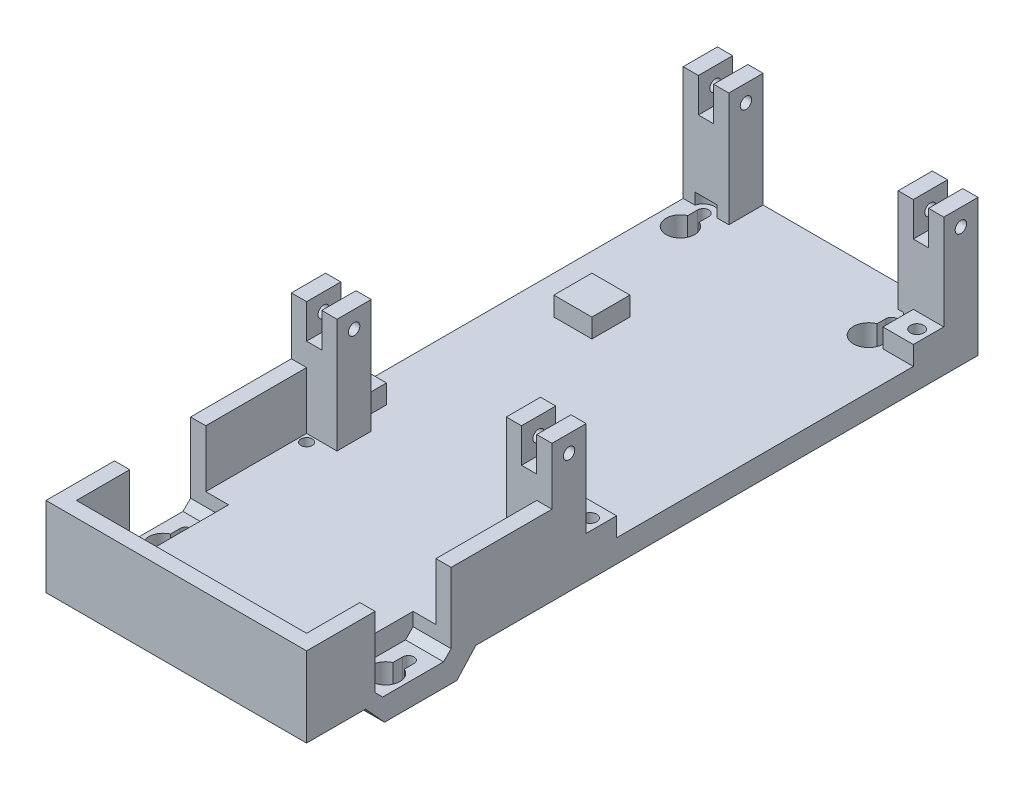
from build123d import *
from OCP.BRepFilletAPI import BRepFilletAPI_MakeChamfer

# Parameters (mm, degrees)
SKETCH1_W            = 68.5
SKETCH1_H            = 64.5
BOSS_EXTRUDE3_DEPTH  = 21
SKETCH3_W            = 60.5
SKETCH3_H            = 60.5
CUT_EXTRUDE1_DEPTH   = 15
SKETCH5_W            = 68.5
SKETCH5_H            = 6
BOSS_EXTRUDE4_DEPTH  = 105
SKETCH10_W           = 10
SKETCH10_H           = 29
BOSS_EXTRUDE5_DEPTH  = 5.5
SKETCH9_W            = 4
SKETCH9_H            = 20
CUT_EXTRUDE2_DEPTH   = 20.5
SKETCH11_W           = 6
SKETCH11_H           = 20
CUT_EXTRUDE3_DEPTH   = 5.5
CHAMFER2_SIZE        = 5.5
CHAMFER2_SIZE_2      = 5
CHAMFER3_SIZE        = 2
SKETCH12_W           = 34.25
SKETCH12_H           = 169.5
CUT_EXTRUDE4_DEPTH   = 50
SKETCH15_R           = 1.5
CUT_EXTRUDE5_DEPTH   = 50
SKETCH16_R           = 1.5
CUT_EXTRUDE6_DEPTH   = 50
SKETCH17_R           = 1.5
CUT_EXTRUDE7_DEPTH   = 50
SKETCH19_W           = 34.25
SKETCH19_H           = 6
BOSS_EXTRUDE6_DEPTH  = 7
SKETCH26_W           = 12
SKETCH26_H           = 9
BOSS_EXTRUDE7_DEPTH  = 30
SKETCH20_R           = 3.75
CUT_EXTRUDE9_DEPTH   = 184.263642057
SKETCH21_W           = 3
SKETCH21_H           = 2.563068229
CUT_EXTRUDE10_DEPTH  = 184.263642057
SKETCH18_R           = 1.5
CUT_EXTRUDE8_DEPTH   = 135
SKETCH24_R           = 4
CUT_EXTRUDE13_DEPTH  = 183.278118544
SKETCH25_W           = 3
SKETCH25_H           = 2.291900756
CUT_EXTRUDE14_DEPTH  = 183.278118544
SKETCH27_R           = 1.75
CUT_EXTRUDE15_DEPTH  = 183.278118544
BOSS_EXTRUDE9_START  = 5
SKETCH30_W           = 8
SKETCH30_H           = 8
SKETCH30_R           = 1.75
BOSS_EXTRUDE9_DEPTH  = 5
SKETCH31_W           = 8
SKETCH31_H           = 8
CUT_EXTRUDE16_DEPTH  = 5
SKETCH32_W           = 19.705511252
SKETCH32_H           = 22.257631466
BOSS_EXTRUDE10_DEPTH = 6
SKETCH33_R           = 1.5
CUT_EXTRUDE17_DEPTH  = 9.74
SKETCH34_R           = 3.75
CUT_EXTRUDE18_DEPTH  = 192.688549475
SKETCH36_R           = 2.5
CUT_EXTRUDE20_DEPTH  = 2
SKETCH39_W           = 3
SKETCH39_H           = 4.259893973
CUT_EXTRUDE22_DEPTH  = 192.688549475
SKETCH41_W           = 12
SKETCH41_H           = 9
BOSS_EXTRUDE11_DEPTH = 30
SKETCH42_R           = 3
CUT_EXTRUDE23_DEPTH  = 3
SKETCH44_W           = 10
SKETCH44_H           = 10
BOSS_EXTRUDE12_DEPTH = 5
SKETCH47_R           = 2.5
CUT_EXTRUDE26_DEPTH  = 3
SKETCH46_W           = 4
SKETCH46_H           = 9
CUT_EXTRUDE27_DEPTH  = 9
CUT_EXTRUDE28_START  = -68.5
SKETCH48_R           = 1.5
CUT_EXTRUDE28_DEPTH  = 68.5


with BuildPart() as part:
    # Sketch1 → Boss-Extrude3 (new body)
    with BuildSketch(Plane(origin=(0, 0, 0), x_dir=(1, 0, 0), z_dir=(0, 1, 0))):
        with Locations((-34.25, 32.25)):
            Rectangle(SKETCH1_W, SKETCH1_H)
    extrude(amount=BOSS_EXTRUDE3_DEPTH)

    # Sketch3 → Cut-Extrude1 (cut)
    with BuildSketch(Plane(origin=(0, 21, 0), x_dir=(1, 0, 0), z_dir=(0, 1, 0))):
        with Locations((-34.25, 34.25)):
            Rectangle(SKETCH3_W, SKETCH3_H)
    extrude(amount=-CUT_EXTRUDE1_DEPTH, mode=Mode.SUBTRACT)

    # Sketch5 → Boss-Extrude4 (add)
    with BuildSketch(Plane(origin=(0, 0, -64.5), x_dir=(-1, 0, 0), z_dir=(0, 0, -1))):
        with Locations((34.25, 3)):
            Rectangle(SKETCH5_W, SKETCH5_H)
    extrude(amount=BOSS_EXTRUDE4_DEPTH)

    # Sketch10 → Boss-Extrude5 (add)
    with BuildSketch(Plane.XZ):
        with Locations((-5, -30)):
            Rectangle(SKETCH10_W, SKETCH10_H)
    extrude(amount=BOSS_EXTRUDE5_DEPTH)

    # Sketch9 → Cut-Extrude2 (cut)
    with BuildSketch(Plane(origin=(0, 21, 0), x_dir=(1, 0, 0), z_dir=(0, 1, 0))):
        with Locations((-2, 28)):
            Rectangle(SKETCH9_W, SKETCH9_H)
    extrude(amount=-CUT_EXTRUDE2_DEPTH, mode=Mode.SUBTRACT)

    # Sketch11 → Cut-Extrude3 (cut)
    with BuildSketch(Plane(origin=(0, 6, 0), x_dir=(1, 0, 0), z_dir=(0, 1, 0))):
        with Locations((-7, 28)):
            Rectangle(SKETCH11_W, SKETCH11_H)
    extrude(amount=-CUT_EXTRUDE3_DEPTH, mode=Mode.SUBTRACT)

    # Chamfer2
    chamfer2_edges_1 = [part.edges().sort_by_distance(p)[0] for p in [
        (-5, -5.5, -44.5),
    ]]
    chamfer2_side_1 = [part.faces().sort_by_distance(p)[0] for p in [
        (-5, -5.4, -44.5),
    ]]
    chamfer2_edges_2 = [part.edges().sort_by_distance(p)[0] for p in [
        (-5, -5.5, -15.5),
    ]]
    chamfer2_side_2 = [part.faces().sort_by_distance(p)[0] for p in [
        (-5, -5.5, -15.6),
    ]]
    chamfer2 = BRepFilletAPI_MakeChamfer(part.part.solid().wrapped)
    for e in chamfer2_edges_1:
        chamfer2.Add(CHAMFER2_SIZE - 0.0001, CHAMFER2_SIZE_2 - 0.0001, e.wrapped, chamfer2_side_1[0].wrapped)
    for e in chamfer2_edges_2:
        chamfer2.Add(CHAMFER2_SIZE_2 - 0.0001, CHAMFER2_SIZE - 0.0001, e.wrapped, chamfer2_side_2[0].wrapped)
    add(Compound.cast(chamfer2.Shape()), mode=Mode.REPLACE)  # a hair under: the kernel refuses the full size

    # Chamfer3
    chamfer3_edges = [part.edges().sort_by_distance(p)[0] for p in [
        (-5, 0.5, -38),
        (-5, 0.5, -18),
    ]]
    chamfer(chamfer3_edges, length=CHAMFER3_SIZE)

    # Sketch12 → Cut-Extrude4 (cut)
    with BuildSketch(Plane(origin=(0, 21, 0), x_dir=(1, 0, 0), z_dir=(0, 1, 0))):
        with Locations((-51.375, 84.75)):
            Rectangle(SKETCH12_W, SKETCH12_H)
    extrude(amount=-CUT_EXTRUDE4_DEPTH, mode=Mode.SUBTRACT)

    # Sketch15 → Cut-Extrude5 (cut)
    with BuildSketch(Plane(origin=(0, 0.5, 0), x_dir=(1, 0, 0), z_dir=(0, 1, 0))):
        with Locations(Location((-5, 31.75713966, 0), (0, 0, 270))):
            Circle(SKETCH15_R)
    extrude(amount=-CUT_EXTRUDE5_DEPTH, mode=Mode.SUBTRACT)

    # Sketch16 → Cut-Extrude6 (cut)
    with BuildSketch(Plane(origin=(0, 6, 0), x_dir=(1, 0, 0), z_dir=(0, 1, 0))):
        with Locations(Location((-6, 6, 0), (0, 0, 270))):
            Circle(SKETCH16_R)
    extrude(amount=-CUT_EXTRUDE6_DEPTH, mode=Mode.SUBTRACT)

    # Sketch17 → Cut-Extrude7 (cut)
    with BuildSketch(Plane(origin=(0, 6, 0), x_dir=(1, 0, 0), z_dir=(0, 1, 0))):
        with Locations(Location((-6, 62.5, 0), (0, 0, 270))):
            Circle(SKETCH17_R)
    extrude(amount=-CUT_EXTRUDE7_DEPTH, mode=Mode.SUBTRACT)

    # Sketch19 → Boss-Extrude6 (add)
    with BuildSketch(Plane(origin=(0, 0, -169.5), x_dir=(-1, 0, 0), z_dir=(0, 0, -1))):
        with Locations((17.125, 3)):
            Rectangle(SKETCH19_W, SKETCH19_H)
    extrude(amount=BOSS_EXTRUDE6_DEPTH)

    # Sketch26 → Boss-Extrude7 (add)
    with BuildSketch(Plane(origin=(0, 6, 0), x_dir=(1, 0, 0), z_dir=(0, 1, 0))):
        with Locations((-6, 69)):
            Rectangle(SKETCH26_W, SKETCH26_H)
    extrude(amount=BOSS_EXTRUDE7_DEPTH)

    # Sketch20 → Cut-Extrude9 (cut, through all)
    with BuildSketch(Plane(origin=(0, 0.5, 0), x_dir=(1, 0, 0), z_dir=(0, 1, 0))):
        with Locations(Location((-5, 25.75713966, 0), (0, 0, 270))):
            Circle(SKETCH20_R)
    extrude(amount=-CUT_EXTRUDE9_DEPTH, mode=Mode.SUBTRACT)

    # Sketch21 → Cut-Extrude10 (cut, through all)
    with BuildSketch(Plane(origin=(0, 0.5, 0), x_dir=(1, 0, 0), z_dir=(0, 1, 0))):
        with Locations((-5, 30.475605546)):
            Rectangle(SKETCH21_W, SKETCH21_H)
    extrude(amount=-CUT_EXTRUDE10_DEPTH, mode=Mode.SUBTRACT)

    # Sketch18 → Cut-Extrude8 (cut)
    with BuildSketch(Plane(origin=(0, 6, 0), x_dir=(1, 0, 0), z_dir=(0, 1, 0))):
        with Locations(Location((-13, 166.75713966, 0), (0, 0, 270))):
            Circle(SKETCH18_R)
    extrude(amount=-CUT_EXTRUDE8_DEPTH, mode=Mode.SUBTRACT)

    # Sketch24 → Cut-Extrude13 (cut, through all)
    with BuildSketch(Plane(origin=(0, 6, 0), x_dir=(1, 0, 0), z_dir=(0, 1, 0))):
        with Locations(Location((-13, 160.75713966, 0), (0, 0, 270))):
            Circle(SKETCH24_R)
    extrude(amount=-CUT_EXTRUDE13_DEPTH, mode=Mode.SUBTRACT)

    # Sketch25 → Cut-Extrude14 (cut, through all)
    with BuildSketch(Plane(origin=(0, 6, 0), x_dir=(1, 0, 0), z_dir=(0, 1, 0))):
        with Locations((-13, 165.611189282)):
            Rectangle(SKETCH25_W, SKETCH25_H)
    extrude(amount=-CUT_EXTRUDE14_DEPTH, mode=Mode.SUBTRACT)

    # Sketch27 → Cut-Extrude15 (cut, through all)
    with BuildSketch(Plane(origin=(0, 6, 0), x_dir=(1, 0, 0), z_dir=(0, 1, 0))):
        with Locations(Location((-3, 77.5, 0), (0, 0, 270))):
            Circle(SKETCH27_R)
        with Locations(Location((-3, 163.5, 0), (0, 0, 270))):
            Circle(SKETCH27_R)
    extrude(amount=-CUT_EXTRUDE15_DEPTH, mode=Mode.SUBTRACT)

    # Sketch30 → Boss-Extrude9 (add)
    # profile 1 of 2: a face of its own
    with BuildSketch(Plane(origin=(0, 6, 0), x_dir=(1, 0, 0), z_dir=(0, 1, 0)).offset(BOSS_EXTRUDE9_START)):
        with Locations((-4, 77.5)):
            Rectangle(SKETCH30_W, SKETCH30_H)
        with Locations(Location((-3, 77.5, 0), (0, 0, 270))):
            Circle(SKETCH30_R, mode=Mode.SUBTRACT)
    # profile 2 of 2: a face of its own
    with BuildSketch(Plane(origin=(0, 6, 0), x_dir=(1, 0, 0), z_dir=(0, 1, 0)).offset(BOSS_EXTRUDE9_START)):
        with Locations((-4, 163.5)):
            Rectangle(SKETCH30_W, SKETCH30_H)
        with Locations(Location((-3, 163.5, 0), (0, 0, 270))):
            Circle(SKETCH30_R, mode=Mode.SUBTRACT)
    extrude(amount=-BOSS_EXTRUDE9_DEPTH)

    # Mirror5: part across plane


with BuildPart() as part_1:
    add(part.part)
    add(part.part.mirror(Plane(origin=(-34.25, 0, 0), x_dir=(0, 0, 1), z_dir=(1, 0, 0))))

    # Sketch31 → Cut-Extrude16 (cut)
    with BuildSketch(Plane(origin=(0, 11, 0), x_dir=(1, 0, 0), z_dir=(0, 1, 0))):
        with Locations((-64.5, 163.5)):
            Rectangle(SKETCH31_W, SKETCH31_H)
    extrude(amount=-CUT_EXTRUDE16_DEPTH, mode=Mode.SUBTRACT)

    # Sketch32 → Boss-Extrude10 (add)
    with BuildSketch(Plane(origin=(0, 6, 0), x_dir=(1, 0, 0), z_dir=(0, 1, 0))):
        with Locations((-58.647244374, 165.371184267)):
            Rectangle(SKETCH32_W, SKETCH32_H)
    extrude(amount=-BOSS_EXTRUDE10_DEPTH)

    # Sketch33 → Cut-Extrude17 (cut)
    with BuildSketch(Plane(origin=(0, 6, 0), x_dir=(1, 0, 0), z_dir=(0, 1, 0))):
        with Locations(Location((-62.5, 166.76, 0), (0, 0, 270))):
            Circle(SKETCH33_R)
    extrude(amount=-CUT_EXTRUDE17_DEPTH, mode=Mode.SUBTRACT)

    # Sketch34 → Cut-Extrude18 (cut, through all)
    with BuildSketch(Plane(origin=(0, 6, 0), x_dir=(1, 0, 0), z_dir=(0, 1, 0))):
        with Locations(Location((-62.5, 160.76, 0), (0, 0, 270))):
            Circle(SKETCH34_R)
    extrude(amount=-CUT_EXTRUDE18_DEPTH, mode=Mode.SUBTRACT)

    # Sketch36 → Cut-Extrude20 (cut)
    with BuildSketch(Plane.XZ):
        with Locations(Location((-3, -77.5, 0), (0, 0, 270))):
            Circle(SKETCH36_R)
        with Locations(Location((-3, -163.5, 0), (0, 0, 270))):
            Circle(SKETCH36_R)
        with Locations(Location((-65.5, -77.5, 0), (0, 0, 270))):
            Circle(SKETCH36_R)
    extrude(amount=-CUT_EXTRUDE20_DEPTH, mode=Mode.SUBTRACT)

    # Sketch39 → Cut-Extrude22 (cut, through all)
    with BuildSketch(Plane(origin=(0, 6, 0), x_dir=(1, 0, 0), z_dir=(0, 1, 0))):
        with Locations((-62.5, 164.630053014)):
            Rectangle(SKETCH39_W, SKETCH39_H)
    extrude(amount=-CUT_EXTRUDE22_DEPTH, mode=Mode.SUBTRACT)

    # Sketch41 → Boss-Extrude11 (add)
    with BuildSketch(Plane(origin=(0, 6, 0), x_dir=(1, 0, 0), z_dir=(0, 1, 0))):
        with Locations((-6, 172)):
            Rectangle(SKETCH41_W, SKETCH41_H)
        with Locations((-62.5, 172)):
            Rectangle(SKETCH41_W, SKETCH41_H)
    extrude(amount=BOSS_EXTRUDE11_DEPTH)

    # Sketch42 → Cut-Extrude23 (cut)
    with BuildSketch(Plane(origin=(0, 6, 0), x_dir=(1, 0, 0), z_dir=(0, 1, 0))):
        with Locations((-62.5, 166.76)):
            Circle(SKETCH42_R)
    extrude(amount=CUT_EXTRUDE23_DEPTH, mode=Mode.SUBTRACT)

    # Sketch44 → Boss-Extrude12 (add)
    with BuildSketch(Plane(origin=(0, 6, 0), x_dir=(1, 0, 0), z_dir=(0, 1, 0))):
        with Locations((-53.5, 128.5)):
            Rectangle(SKETCH44_W, SKETCH44_H)
    extrude(amount=BOSS_EXTRUDE12_DEPTH)

    # Sketch47 → Cut-Extrude26 (cut)
    with BuildSketch(Plane(origin=(0, 6, 0), x_dir=(1, 0, 0), z_dir=(0, 1, 0))):
        with Locations((-13, 166.75713966)):
            Circle(SKETCH47_R)
    extrude(amount=CUT_EXTRUDE26_DEPTH, mode=Mode.SUBTRACT)

    # Sketch46 → Cut-Extrude27 (cut)
    with BuildSketch(Plane(origin=(0, 36, 0), x_dir=(1, 0, 0), z_dir=(0, 1, 0))):
        with Locations((-6, 69)):
            Rectangle(SKETCH46_W, SKETCH46_H)
        with Locations((-62.5, 69)):
            Rectangle(SKETCH46_W, SKETCH46_H)
        with Locations((-62.5, 172)):
            Rectangle(SKETCH46_W, SKETCH46_H)
        with Locations((-6, 172)):
            Rectangle(SKETCH46_W, SKETCH46_H)
    extrude(amount=-CUT_EXTRUDE27_DEPTH, mode=Mode.SUBTRACT)

    # Sketch48 → Cut-Extrude28 (cut)
    with BuildSketch(Plane(origin=(0, 0, 0), x_dir=(0, 0, -1), z_dir=(1, 0, 0)).offset(CUT_EXTRUDE28_START)):
        with Locations((69, 31.5)):
            Circle(SKETCH48_R)
        with Locations((172, 31.5)):
            Circle(SKETCH48_R)
    extrude(amount=CUT_EXTRUDE28_DEPTH, mode=Mode.SUBTRACT)


solid = part_1.part
